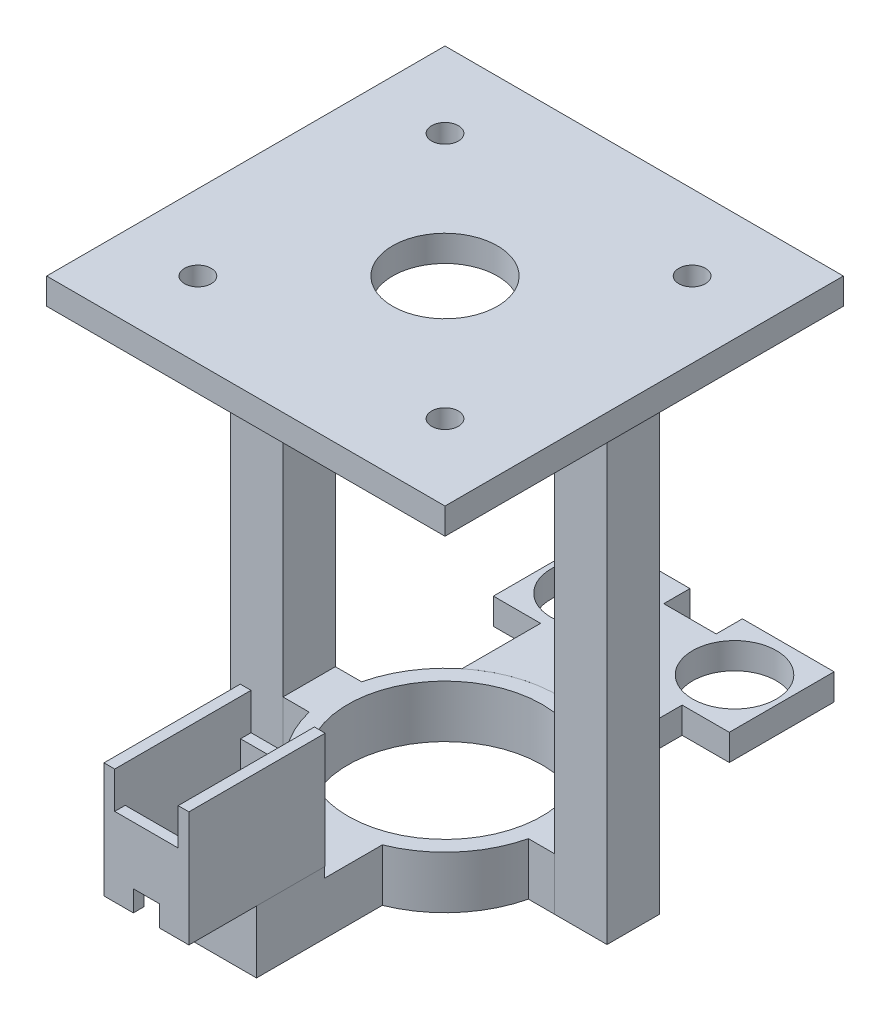
from build123d import *

# Parameters (mm, degrees)
CONNECTOR_SLEEVE_DEPTH      = 5
CONNECTOR_SLEEVE_DEPTH_BACK = 5
SKETCH2_R                   = 18.5
SKETCH2_10_R                = 8
SENSOR_HOLDER_DEPTH         = 5
ARMS_START                  = -5
SKETCH2_18_W                = 10
SKETCH2_18_H                = 10
ARMS_DEPTH                  = 85
ARMS_2_DEPTH                = 85
ARMS2_START                 = -5
ARMS2_DEPTH                 = 10
SERVOHOLDER_START           = -5
SERVOHOLDER_DEPTH           = 10
SKETCH31_W                  = 16
SKETCH31_H                  = 13
SERVOHOLDER2_DEPTH          = 2
SKETCH33_W                  = 16.2
SKETCH33_H                  = 26
SKETCH33_W_2                = 12.1
SKETCH33_H_2                = 22
SERVOHOLDER3_DEPTH          = 22
SERVOHOLDER4_W              = 12.1
SERVOHOLDER4_H              = 2
SERVOGROOVES_DEPTH          = 7
SKETCH36_W                  = 5
SKETCH36_H                  = 4
SERVOWIRING_DEPTH           = 2
SKETCH4_W                   = 76
SKETCH4_H                   = 76
SKETCH4_R                   = 10
MOTOR_ENCLOSURE_DEPTH       = 5
SKETCH6_R                   = 2.55
CUT_EXTRUDE1_DEPTH          = 10


with BuildPart() as part:
    # Sketch2 → Connector sleeve (new, two sides: drawn at the far end of the back side and taken through both)
    with BuildSketch(Plane(origin=(0, 0, 0), x_dir=(1, 0, 0), z_dir=(0, 1, 0)).offset(-CONNECTOR_SLEEVE_DEPTH_BACK)):
        with BuildLine():
            ThreePointArc((-13.5, 16.733200531), (-18.177954599, 11.480939273), (-20.910523666, 5))
            ThreePointArc((-20.910523666, 5), (-21.5, 0), (-20.910523666, -5))
            ThreePointArc((-20.910523666, -5), (-16.275029633, -14.048964746), (-8, -19.956202043))
            ThreePointArc((-8, -19.956202043), (0, -21.5), (8, -19.956202043))
            ThreePointArc((8, -19.956202043), (16.275029633, -14.048964746), (20.910523666, -5))
            ThreePointArc((20.910523666, -5), (21.352122363, -2.517314161), (21.5, 0))
            ThreePointArc((21.5, 0), (21.352122363, 2.517314161), (20.910523666, 5))
            ThreePointArc((20.910523666, 5), (18.177954599, 11.480939273), (13.5, 16.733200531))
            ThreePointArc((13.5, 16.733200531), (0, 21.5), (-13.5, 16.733200531))
        make_face()
        Circle(SKETCH2_R, mode=Mode.SUBTRACT)
    extrude(amount=CONNECTOR_SLEEVE_DEPTH + CONNECTOR_SLEEVE_DEPTH_BACK)

    # Sketch2<22> → Arms2 (add)
    with BuildSketch(Plane(origin=(0, 0, 0), x_dir=(1, 0, 0), z_dir=(0, 1, 0)).offset(ARMS2_START)):
        with BuildLine():
            ThreePointArc((-20.910523666, -5), (-21.5, 0), (-20.910523666, 5))
            Line((-20.910523666, 5), (-35.910523666, 5))
            Line((-35.910523666, 5), (-35.910523666, -5))
            Line((-35.910523666, -5), (-20.910523666, -5))
        make_face()
        with BuildLine():
            ThreePointArc((20.910523666, 5), (21.5, 0), (20.910523666, -5))
            Line((20.910523666, -5), (35.910523666, -5))
            Line((35.910523666, -5), (35.910523666, 5))
            Line((35.910523666, 5), (20.910523666, 5))
        make_face()
    extrude(amount=ARMS2_DEPTH)

    # Sketch2<21> → Servoholder (add)
    with BuildSketch(Plane(origin=(0, 0, 0), x_dir=(1, 0, 0), z_dir=(0, 1, 0)).offset(SERVOHOLDER_START)):
        with BuildLine():
            ThreePointArc((8, -19.956202043), (0, -21.5), (-8, -19.956202043))
            Line((-8, -19.956202043), (-8, -43.956202043))
            Line((-8, -43.956202043), (8, -43.956202043))
            Line((8, -43.956202043), (8, -19.956202043))
        make_face()
    extrude(amount=SERVOHOLDER_DEPTH)

    # Sketch31 → Servoholder2 (add)
    with BuildSketch(Plane(origin=(0, 5, 0), x_dir=(1, 0, 0), z_dir=(0, 1, 0))):
        with Locations((0, -37.456202043)):
            Rectangle(SKETCH31_W, SKETCH31_H)
    extrude(amount=SERVOHOLDER2_DEPTH)

    # Sketch33 → Servoholder3 (add)
    with BuildSketch(Plane(origin=(0, 7, 0), x_dir=(1, 0, 0), z_dir=(0, 1, 0))):
        with Locations((0, -43.956202043)):
            Rectangle(SKETCH33_W, SKETCH33_H)
        with Locations((0, -43.956202043)):
            Rectangle(SKETCH33_W_2, SKETCH33_H_2, mode=Mode.SUBTRACT)
    extrude(amount=SERVOHOLDER3_DEPTH)

    # Servoholder4 → Servogrooves (cut)
    with BuildSketch(Plane(origin=(0, 29, 0), x_dir=(1, 0, 0), z_dir=(0, 1, 0))):
        with Locations((0, -31.956202043)):
            Rectangle(SERVOHOLDER4_W, SERVOHOLDER4_H)
        with Locations((0, -55.956202043)):
            Rectangle(SERVOHOLDER4_W, SERVOHOLDER4_H)
    extrude(amount=-SERVOGROOVES_DEPTH, mode=Mode.SUBTRACT)

    # Sketch36 → Servowiring (cut)
    with BuildSketch(Plane.XY.offset(56.956202043)):
        with Locations((0, 9)):
            Rectangle(SKETCH36_W, SKETCH36_H)
    extrude(amount=-SERVOWIRING_DEPTH, mode=Mode.SUBTRACT)


with BuildPart() as body_2:
    # Sketch2<10> → Sensor holder (new body)
    with BuildSketch(Plane(origin=(0, 0, 0), x_dir=(1, 0, 0), z_dir=(0, 1, 0))):
        with BuildLine():
            Line((-13.5, 31.733200531), (-13.5, 16.733200531))
            ThreePointArc((-13.5, 16.733200531), (0, 21.5), (13.5, 16.733200531))
            Line((13.5, 16.733200531), (13.5, 31.733200531))
            Line((13.5, 31.733200531), (22.5, 31.733200531))
            Line((22.5, 31.733200531), (22.5, 51.733200531))
            Line((22.5, 51.733200531), (5, 51.733200531))
            Line((5, 51.733200531), (5, 46.733200531))
            Line((5, 46.733200531), (-5, 46.733200531))
            Line((-5, 46.733200531), (-5, 51.733200531))
            Line((-5, 51.733200531), (-22.5, 51.733200531))
            Line((-22.5, 51.733200531), (-22.5, 31.733200531))
            Line((-22.5, 31.733200531), (-13.5, 31.733200531))
        make_face()
        with Locations((-13.5, 41.733200531)):
            Circle(SKETCH2_10_R, mode=Mode.SUBTRACT)
        with Locations((13.5, 41.733200531)):
            Circle(SKETCH2_10_R, mode=Mode.SUBTRACT)
    extrude(amount=SENSOR_HOLDER_DEPTH)


with BuildPart() as body_3:
    # Sketch2<18> → Arms (new body)
    with BuildSketch(Plane(origin=(0, 0, 0), x_dir=(1, 0, 0), z_dir=(0, 1, 0)).offset(ARMS_START)):
        with Locations((-30.910523666, 0)):
            Rectangle(SKETCH2_18_W, SKETCH2_18_H)
    extrude(amount=ARMS_DEPTH)


with BuildPart() as body_4:
    # Sketch2<18> → Arms 2 (new body)
    with BuildSketch(Plane(origin=(0, 0, 0), x_dir=(1, 0, 0), z_dir=(0, 1, 0)).offset(ARMS_START)):
        with Locations((30.910523666, 0)):
            Rectangle(SKETCH2_18_W, SKETCH2_18_H)
    extrude(amount=ARMS_2_DEPTH)


with BuildPart() as body_5:
    # Sketch4 → Motor enclosure (new body)
    with BuildSketch(Plane(origin=(0, 80, 0), x_dir=(1, 0, 0), z_dir=(0, 1, 0))):
        Rectangle(SKETCH4_W, SKETCH4_H)
        Circle(SKETCH4_R, mode=Mode.SUBTRACT)
    extrude(amount=MOTOR_ENCLOSURE_DEPTH)

    # Sketch6 → Cut-Extrude1 (cut)
    with BuildSketch(Plane(origin=(0, 85, 0), x_dir=(1, 0, 0), z_dir=(0, 1, 0))):
        with Locations((23.57, -23.57)):
            Circle(SKETCH6_R)
        with Locations((-23.57, -23.57)):
            Circle(SKETCH6_R)
        with Locations((-23.57, 23.57)):
            Circle(SKETCH6_R)
        with Locations((23.57, 23.57)):
            Circle(SKETCH6_R)
    extrude(amount=-CUT_EXTRUDE1_DEPTH, mode=Mode.SUBTRACT)


solid = Compound([part.part, body_2.part, body_3.part, body_4.part, body_5.part])
